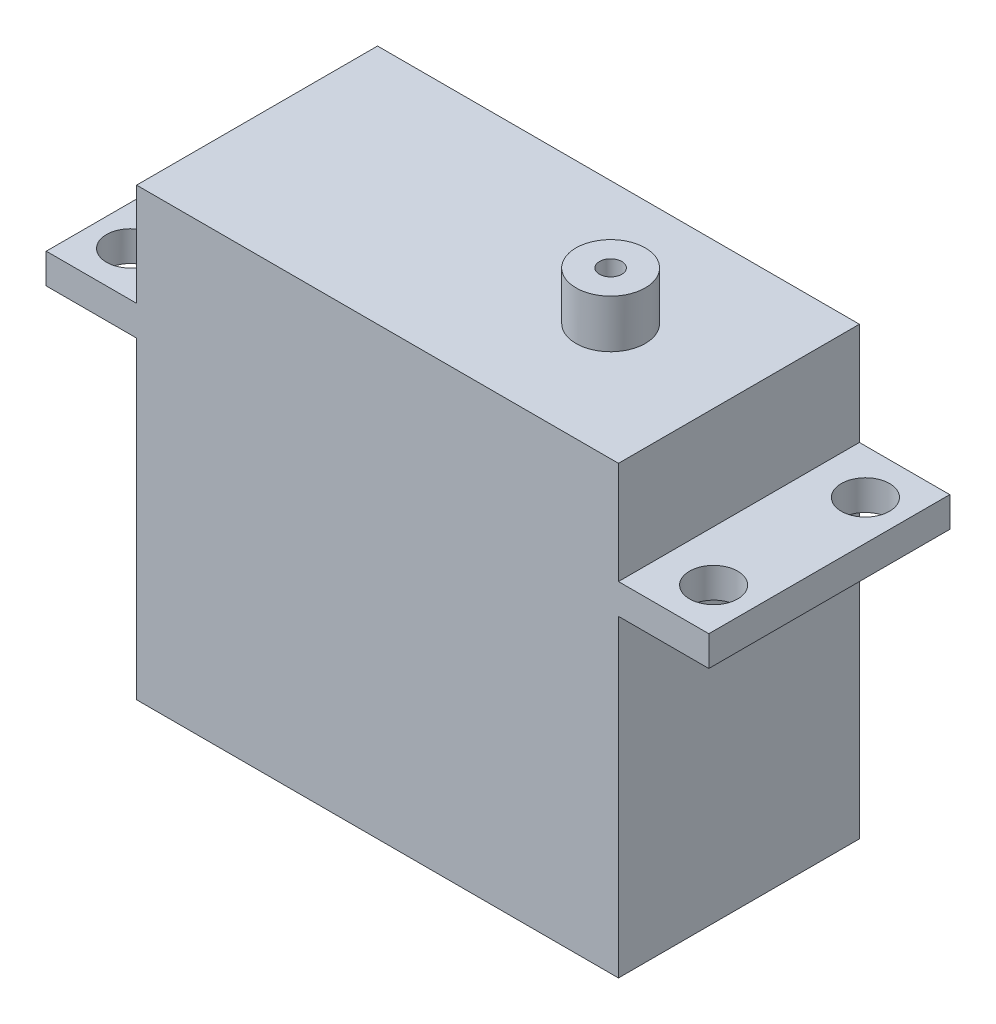
from build123d import *

# Parameters (mm, degrees)
SKETCH1_W                        = 40
SKETCH1_H                        = 20
BODY_DEPTH                       = 37
SKETCH2_W                        = 7.5
SKETCH2_H                        = 20
FLANGES_DEPTH                    = 2.5
F_4_0_4_DIAMETER_HOLE1_D         = 4
SKETCH5_R                        = 2.875
AXLE_DEPTH                       = 4
F_1_85_1_85_DIAMETER_HOLE1_D     = 1.85
F_1_85_1_85_DIAMETER_HOLE1_DEPTH = 4
F_1_85_1_85_DIAMETER_HOLE1_TIP   = 0.555796073


with BuildPart() as part:
    # Sketch1 → Body (new body)
    with BuildSketch(Plane(origin=(0, 0, 0), x_dir=(1, 0, 0), z_dir=(0, 1, 0))):
        Rectangle(SKETCH1_W, SKETCH1_H)
    extrude(amount=BODY_DEPTH)

    # Sketch2 → Flanges (add)
    with BuildSketch(Plane(origin=(0, 26, 0), x_dir=(1, 0, 0), z_dir=(0, 1, 0))):
        with Locations((23.75, 0)):
            Rectangle(SKETCH2_W, SKETCH2_H)
        with Locations((-23.75, 0)):
            Rectangle(SKETCH2_W, SKETCH2_H)
    extrude(amount=FLANGES_DEPTH)

    # Ø4.0 (4) Diameter Hole1 (through all)
    with Locations(Plane(origin=(0, 28.5, 0), x_dir=(1, 0, 0), z_dir=(0, 1, 0))):
        with Locations((-24.2, -6.3), (-24.2, 6.3), (24.2, 6.3), (24.2, -6.3)):
            Hole(F_4_0_4_DIAMETER_HOLE1_D / 2)

    # Sketch5 → Axle (add)
    with BuildSketch(Plane(origin=(0, 37, 0), x_dir=(1, 0, 0), z_dir=(0, 1, 0))):
        with Locations((9.625, -0.275)):
            Circle(SKETCH5_R)
    extrude(amount=AXLE_DEPTH)

    # Ø1.85 (1.85) Diameter Hole1
    with Locations(Plane(origin=(0, 41, 0), x_dir=(1, 0, 0), z_dir=(0, 1, 0))):
        with Locations((9.625, -0.275)):
            Hole(F_1_85_1_85_DIAMETER_HOLE1_D / 2, depth=F_1_85_1_85_DIAMETER_HOLE1_DEPTH)
            with Locations((0, 0, -(F_1_85_1_85_DIAMETER_HOLE1_DEPTH + F_1_85_1_85_DIAMETER_HOLE1_TIP / 2))):  # 118° drill point
                Cone(0, F_1_85_1_85_DIAMETER_HOLE1_D / 2, F_1_85_1_85_DIAMETER_HOLE1_TIP, mode=Mode.SUBTRACT)


solid = part.part
